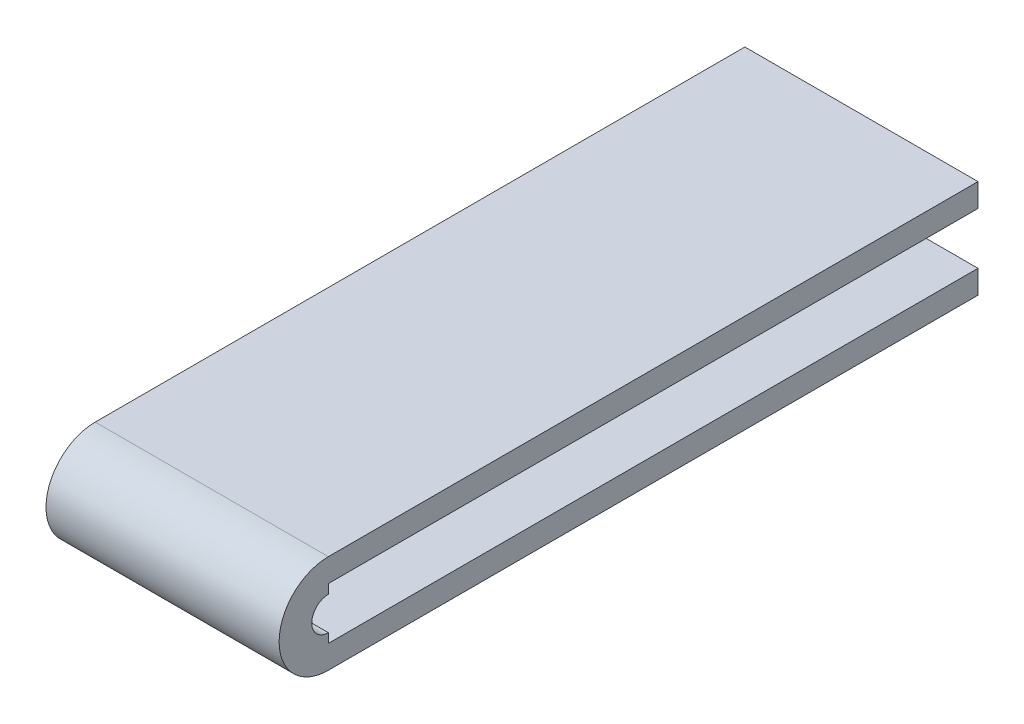
from build123d import *

# Parameters (mm, degrees)
BOSS_EXTRUDE1_DEPTH = 28.575


with BuildPart() as part:
    # Sketch1 → Boss-Extrude1 (new body)
    with BuildSketch(Plane(origin=(0, 0, 0), x_dir=(0, 0, -1), z_dir=(1, 0, 0))):
        with BuildLine():
            Line((79.6417, 6.0325), (0, 6.0325))
            ThreePointArc((0, 6.0325), (-6.0325, 0), (0, -6.0325))
            Line((0, -6.0325), (79.6417, -6.0325))
            Line((79.6417, -6.0325), (79.6417, -3.175))
            Line((79.6417, -3.175), (0, -3.175))
            Line((0, -3.175), (0, -2.032))
            ThreePointArc((0, -2.032), (-2.032, 0), (0, 2.032))
            Line((0, 2.032), (0, 3.175))
            Line((0, 3.175), (79.6417, 3.175))
            Line((79.6417, 3.175), (79.6417, 6.0325))
        make_face()
    extrude(amount=BOSS_EXTRUDE1_DEPTH)


solid = part.part
